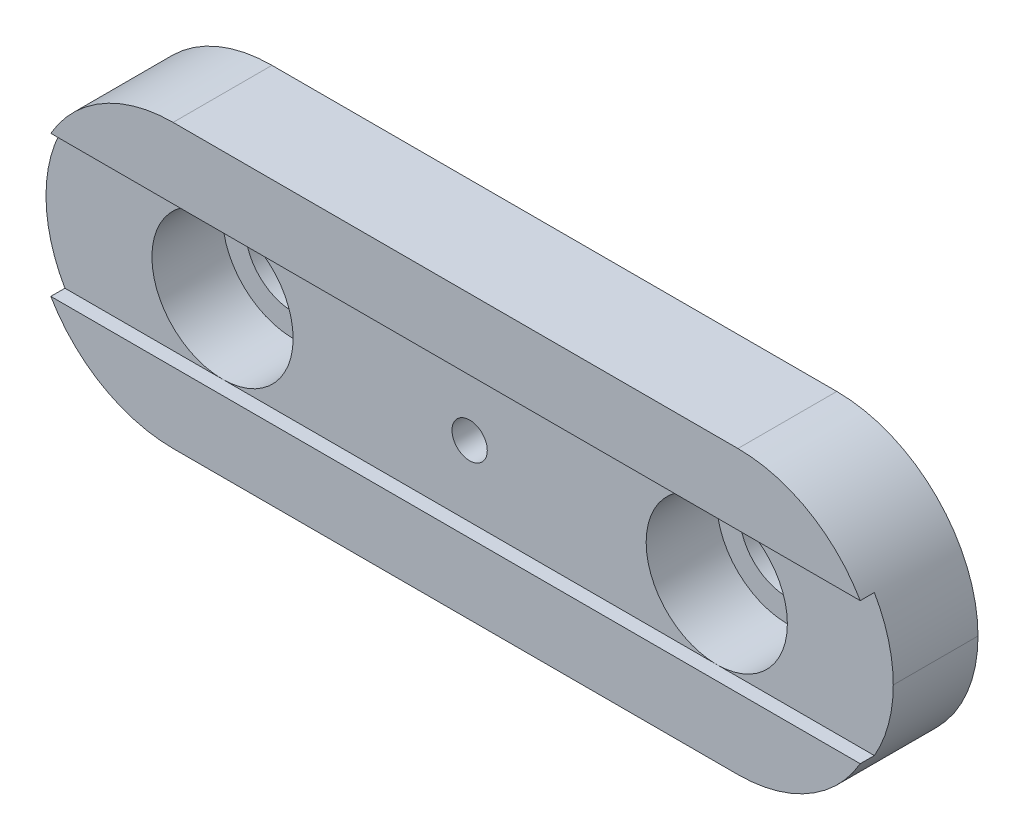
from build123d import *

# Parameters (mm, degrees)
SKETCH_1_W                    = 120
SKETCH_1_H                    = 40
EXTRUDE_1_DEPTH               = 14
SKETCH_2_W                    = 120
SKETCH_2_H                    = 20
CUT_EXTRUDE_1_DEPTH           = 2
HOLE_WIZARD_M12_1_D           = 13.5
HOLE_WIZARD_M12_1_CBORE_D     = 20
HOLE_WIZARD_M12_1_CBORE_DEPTH = 10
FILLET_1_R                    = 20
HOLE_WIZARD_M6_1_D            = 5


with BuildPart() as part:
    # 草图1 → 凸台-拉伸1 (new body)
    with BuildSketch(Plane.XY):
        Rectangle(SKETCH_1_W, SKETCH_1_H)
    extrude(amount=EXTRUDE_1_DEPTH)

    # 草图2 → 切除-拉伸1 (cut)
    with BuildSketch(Plane.XY.offset(14)):
        Rectangle(SKETCH_2_W, SKETCH_2_H)
    extrude(amount=-CUT_EXTRUDE_1_DEPTH, mode=Mode.SUBTRACT)

    # M12 六角头螺栓的柱形沉头孔1 (through all)
    with Locations(Plane.XY.offset(12)):
        with Locations((-35, 0), (35, 0)):
            CounterBoreHole(HOLE_WIZARD_M12_1_D / 2, HOLE_WIZARD_M12_1_CBORE_D / 2, HOLE_WIZARD_M12_1_CBORE_DEPTH)

    # 圆角1
    fillet_1_edges = [part.edges().sort_by_distance(p)[0] for p in [
        (60, 20, 7),
        (60, -20, 7),
        (-60, -20, 7),
        (-60, 20, 7),
    ]]
    fillet(fillet_1_edges, radius=FILLET_1_R - 0.0001)  # a hair under: the kernel refuses the full size

    # M6 螺纹孔1 (through all)
    with Locations(Plane.XY.offset(12)):
        with Locations((0, 0)):
            Hole(HOLE_WIZARD_M6_1_D / 2)


solid = part.part
